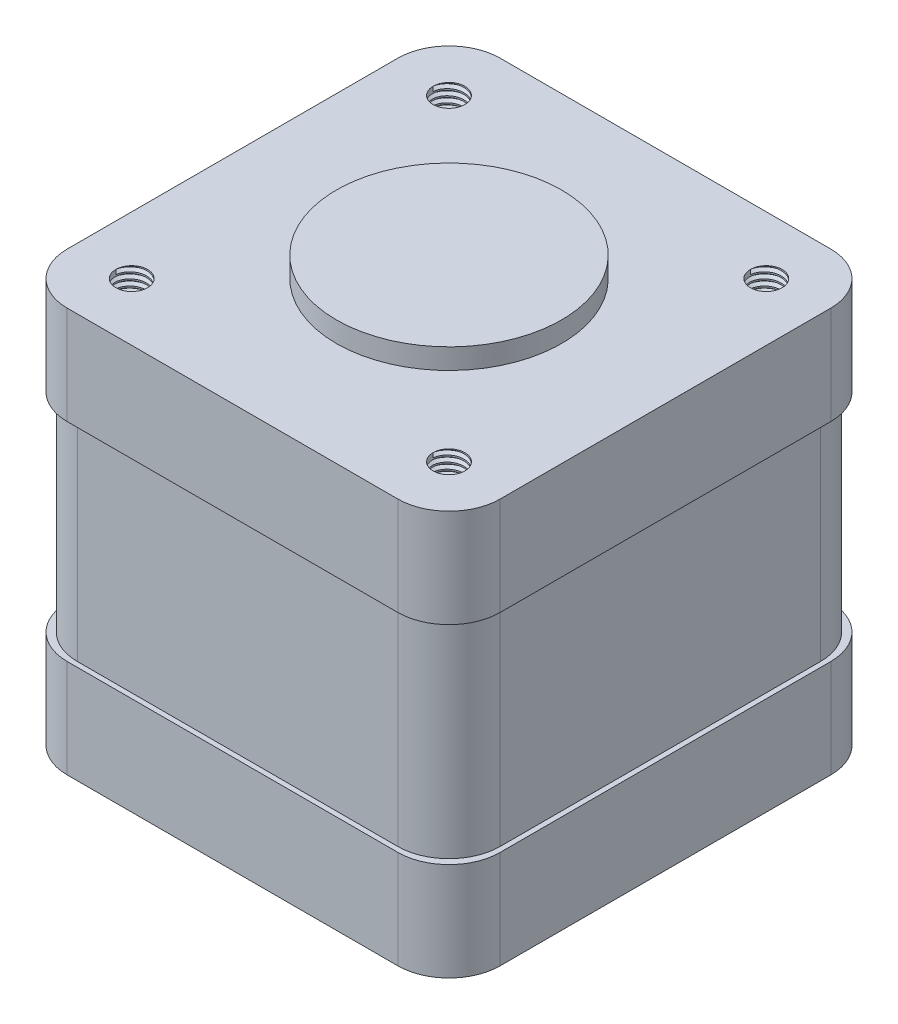
from build123d import *
from build123d.topology import SkipClean

# Parameters (mm, degrees)
BOSS_EXTRUDE1_DEPTH           = 9.6
BOSS_EXTRUDE2_DEPTH           = 20.3
BOSS_EXTRUDE3_DEPTH           = 9.6
SKETCH4_R                     = 1.55
CUT_EXTRUDE1_DEPTH            = 4.5
MINCOLWIDTH_ONTRACKING2_PITCH = 0.6
MINCOLWIDTH_ONTRACKING3_PITCH = 0.6
MINCOLWIDTH_ONTRACKING4_PITCH = 0.6
MINCOLWIDTH_ONTRACKING5_PITCH = 0.6
SKETCH18_R                    = 11
BOSS_EXTRUDE4_DEPTH           = 2


with BuildPart() as part:
    # Sketch1 → Boss-Extrude1 (new body)
    with BuildSketch(Plane(origin=(0, 0, 0), x_dir=(1, 0, 0), z_dir=(0, 1, 0))):
        with BuildLine():
            Line((5, 0), (37.3, 0))
            ThreePointArc((37.3, 0), (40.835533906, 1.464466094), (42.3, 5))
            Line((42.3, 5), (42.3, 37.3))
            ThreePointArc((42.3, 37.3), (40.835533906, 40.835533906), (37.3, 42.3))
            Line((37.3, 42.3), (5, 42.3))
            ThreePointArc((5, 42.3), (1.464466094, 40.835533906), (0, 37.3))
            Line((0, 37.3), (0, 5))
            ThreePointArc((0, 5), (1.464466094, 1.464466094), (5, 0))
        make_face()
    extrude(amount=BOSS_EXTRUDE1_DEPTH)

    # Sketch2 → Boss-Extrude2 (add)
    with BuildSketch(Plane(origin=(0, 9.6, 0), x_dir=(1, 0, 0), z_dir=(0, 1, 0))):
        with BuildLine():
            Line((5.5, 0.496711466), (36.8, 0.496711466))
            ThreePointArc((36.8, 0.496711466), (40.335533906, 1.96117756), (41.8, 5.496711466))
            Line((41.8, 5.496711466), (41.8, 36.8))
            ThreePointArc((41.8, 36.8), (40.335533906, 40.335533906), (36.8, 41.8))
            Line((36.8, 41.8), (5.5, 41.8))
            ThreePointArc((5.5, 41.8), (1.964466094, 40.335533906), (0.5, 36.8))
            Line((0.5, 36.8), (0.5, 5.496711466))
            ThreePointArc((0.5, 5.496711466), (1.964466094, 1.96117756), (5.5, 0.496711466))
        make_face()
    extrude(amount=BOSS_EXTRUDE2_DEPTH)

    # Sketch3 → Boss-Extrude3 (add)
    with BuildSketch(Plane(origin=(0, 29.9, 0), x_dir=(1, 0, 0), z_dir=(0, 1, 0))):
        with BuildLine():
            Line((5, 42.3), (37.3, 42.3))
            ThreePointArc((37.3, 42.3), (40.835533906, 40.835533906), (42.3, 37.3))
            Line((42.3, 37.3), (42.3, 5))
            ThreePointArc((42.3, 5), (40.835533906, 1.464466094), (37.3, 0))
            Line((37.3, 0), (5, 0))
            ThreePointArc((5, 0), (1.464466094, 1.464466094), (0, 5))
            Line((0, 5), (0, 37.3))
            ThreePointArc((0, 37.3), (1.464466094, 40.835533906), (5, 42.3))
        make_face()
    extrude(amount=BOSS_EXTRUDE3_DEPTH)

    # Sketch4 → Cut-Extrude1 (cut)
    with BuildSketch(Plane(origin=(0, 39.5, 0), x_dir=(1, 0, 0), z_dir=(0, 1, 0))):
        with Locations(Location((5.65, 36.65, 0), (0, 0, 270))):
            Circle(SKETCH4_R)
        with Locations(Location((36.65, 36.65, 0), (0, 0, 90))):
            Circle(SKETCH4_R)
        with Locations(Location((5.65, 5.65, 0), (0, 0, 90))):
            Circle(SKETCH4_R)
        with Locations(Location((36.65, 5.65, 0), (0, 0, 270))):
            Circle(SKETCH4_R)
    extrude(amount=-CUT_EXTRUDE1_DEPTH, mode=Mode.SUBTRACT)

    # MinColWidth_OnTracking2: the profile of HeaderRowsCount2 profile screwed along a right-hand helix of 7.5 turns, 6 arcs to a turn; built about Z, then put on its axis
    with SkipClean():  # the faces are left unmerged after this step: merging them gives an invalid solid
        mincolwidth_ontracking2_z = Axis((0, 0, 0), (0, 0, 1))
        mincolwidth_ontracking2_corners = [(1.5497, 0, -0.000173205), (1.874759525, 0, 0.187499999), (1.874759525, 0, 0.262499999), (1.5497, 0, 0.450173203)]
        with BuildLine(mode=Mode.PRIVATE) as mincolwidth_ontracking2_profile:
            Line(mincolwidth_ontracking2_corners[0], mincolwidth_ontracking2_corners[1])
            Line(mincolwidth_ontracking2_corners[1], mincolwidth_ontracking2_corners[2])
            Line(mincolwidth_ontracking2_corners[2], mincolwidth_ontracking2_corners[3])
            Line(mincolwidth_ontracking2_corners[3], mincolwidth_ontracking2_corners[0])
        mincolwidth_ontracking2_cap = Face(mincolwidth_ontracking2_profile.wire())
        mincolwidth_ontracking2_turn_angles = [0, 30, 60, 90, 120, 150, 180, 210, 240, 270, 300, 330, 360]
        mincolwidth_ontracking2_turn_weights = [1, 0.8660254037844387, 1, 0.8660254037844387, 1, 0.8660254037844387, 1, 0.8660254037844387, 1, 0.8660254037844387, 1, 0.8660254037844387, 1]
        mincolwidth_ontracking2_turn_rails = [Edge.make_bspline([Vector(p[0], p[1], 0).rotate(mincolwidth_ontracking2_z, mincolwidth_ontracking2_turn_angles[k]) / mincolwidth_ontracking2_turn_weights[k] + Vector(0, 0, p[2] + MINCOLWIDTH_ONTRACKING2_PITCH * mincolwidth_ontracking2_turn_angles[k] / 360) for k in range(13)], [0, 0, 0, 1, 1, 2, 2, 3, 3, 4, 4, 5, 5, 6, 6, 6], 2, mincolwidth_ontracking2_turn_weights) for p in mincolwidth_ontracking2_corners]
        mincolwidth_ontracking2_turn_sides = [Face.make_surface_from_curves(mincolwidth_ontracking2_turn_rails[p[0]], mincolwidth_ontracking2_turn_rails[p[1]]) for p in [(0, 1), (1, 2), (2, 3), (3, 0)]]
        mincolwidth_ontracking2_last_angles = [2520, 2550, 2580, 2610, 2640, 2670, 2700]
        mincolwidth_ontracking2_last_weights = [1, 0.8660254037844387, 1, 0.8660254037844387, 1, 0.8660254037844387, 1]
        mincolwidth_ontracking2_last_rails = [Edge.make_bspline([Vector(p[0], p[1], 0).rotate(mincolwidth_ontracking2_z, mincolwidth_ontracking2_last_angles[k]) / mincolwidth_ontracking2_last_weights[k] + Vector(0, 0, p[2] + MINCOLWIDTH_ONTRACKING2_PITCH * mincolwidth_ontracking2_last_angles[k] / 360) for k in range(7)], [0, 0, 0, 1, 1, 2, 2, 3, 3, 3], 2, mincolwidth_ontracking2_last_weights) for p in mincolwidth_ontracking2_corners]
        mincolwidth_ontracking2_last_sides = [Face.make_surface_from_curves(mincolwidth_ontracking2_last_rails[p[0]], mincolwidth_ontracking2_last_rails[p[1]]) for p in [(0, 1), (1, 2), (2, 3), (3, 0)]]
        mincolwidth_ontracking2 = Plane(origin=(5.65, 39.5, -36.65), x_dir=(-1, 0, 0), z_dir=(0, -1, 0)) * Solid(Shell([*[p.moved(Location((0, 0, MINCOLWIDTH_ONTRACKING2_PITCH * i))) for i in range(7) for p in mincolwidth_ontracking2_turn_sides], *mincolwidth_ontracking2_last_sides, mincolwidth_ontracking2_cap, mincolwidth_ontracking2_cap.rotate(mincolwidth_ontracking2_z, 2700).moved(Location((0, 0, MINCOLWIDTH_ONTRACKING2_PITCH * 2700 / 360)))]))
        add(mincolwidth_ontracking2, mode=Mode.SUBTRACT)

    # MinColWidth_OnTracking3: the profile of HeaderRowsCount3 profile screwed along a right-hand helix of 7.5 turns, 6 arcs to a turn; built about Z, then put on its axis
    with SkipClean():  # the faces are left unmerged after this step: merging them gives an invalid solid
        mincolwidth_ontracking3_z = Axis((0, 0, 0), (0, 0, 1))
        mincolwidth_ontracking3_corners = [(1.5497, 0, -0.000173205), (1.874759525, 0, 0.187499999), (1.874759525, 0, 0.262499999), (1.5497, 0, 0.450173203)]
        with BuildLine(mode=Mode.PRIVATE) as mincolwidth_ontracking3_profile:
            Line(mincolwidth_ontracking3_corners[0], mincolwidth_ontracking3_corners[1])
            Line(mincolwidth_ontracking3_corners[1], mincolwidth_ontracking3_corners[2])
            Line(mincolwidth_ontracking3_corners[2], mincolwidth_ontracking3_corners[3])
            Line(mincolwidth_ontracking3_corners[3], mincolwidth_ontracking3_corners[0])
        mincolwidth_ontracking3_cap = Face(mincolwidth_ontracking3_profile.wire())
        mincolwidth_ontracking3_turn_angles = [0, 30, 60, 90, 120, 150, 180, 210, 240, 270, 300, 330, 360]
        mincolwidth_ontracking3_turn_weights = [1, 0.8660254037844387, 1, 0.8660254037844387, 1, 0.8660254037844387, 1, 0.8660254037844387, 1, 0.8660254037844387, 1, 0.8660254037844387, 1]
        mincolwidth_ontracking3_turn_rails = [Edge.make_bspline([Vector(p[0], p[1], 0).rotate(mincolwidth_ontracking3_z, mincolwidth_ontracking3_turn_angles[k]) / mincolwidth_ontracking3_turn_weights[k] + Vector(0, 0, p[2] + MINCOLWIDTH_ONTRACKING3_PITCH * mincolwidth_ontracking3_turn_angles[k] / 360) for k in range(13)], [0, 0, 0, 1, 1, 2, 2, 3, 3, 4, 4, 5, 5, 6, 6, 6], 2, mincolwidth_ontracking3_turn_weights) for p in mincolwidth_ontracking3_corners]
        mincolwidth_ontracking3_turn_sides = [Face.make_surface_from_curves(mincolwidth_ontracking3_turn_rails[p[0]], mincolwidth_ontracking3_turn_rails[p[1]]) for p in [(0, 1), (1, 2), (2, 3), (3, 0)]]
        mincolwidth_ontracking3_last_angles = [2520, 2550, 2580, 2610, 2640, 2670, 2700]
        mincolwidth_ontracking3_last_weights = [1, 0.8660254037844387, 1, 0.8660254037844387, 1, 0.8660254037844387, 1]
        mincolwidth_ontracking3_last_rails = [Edge.make_bspline([Vector(p[0], p[1], 0).rotate(mincolwidth_ontracking3_z, mincolwidth_ontracking3_last_angles[k]) / mincolwidth_ontracking3_last_weights[k] + Vector(0, 0, p[2] + MINCOLWIDTH_ONTRACKING3_PITCH * mincolwidth_ontracking3_last_angles[k] / 360) for k in range(7)], [0, 0, 0, 1, 1, 2, 2, 3, 3, 3], 2, mincolwidth_ontracking3_last_weights) for p in mincolwidth_ontracking3_corners]
        mincolwidth_ontracking3_last_sides = [Face.make_surface_from_curves(mincolwidth_ontracking3_last_rails[p[0]], mincolwidth_ontracking3_last_rails[p[1]]) for p in [(0, 1), (1, 2), (2, 3), (3, 0)]]
        mincolwidth_ontracking3 = Plane(origin=(36.65, 39.5, -36.65), x_dir=(-1, 0, 0), z_dir=(0, -1, 0)) * Solid(Shell([*[p.moved(Location((0, 0, MINCOLWIDTH_ONTRACKING3_PITCH * i))) for i in range(7) for p in mincolwidth_ontracking3_turn_sides], *mincolwidth_ontracking3_last_sides, mincolwidth_ontracking3_cap, mincolwidth_ontracking3_cap.rotate(mincolwidth_ontracking3_z, 2700).moved(Location((0, 0, MINCOLWIDTH_ONTRACKING3_PITCH * 2700 / 360)))]))
        add(mincolwidth_ontracking3, mode=Mode.SUBTRACT)

    # MinColWidth_OnTracking4: the profile of HeaderRowsCount4 profile screwed along a right-hand helix of 7.5 turns, 6 arcs to a turn; built about Z, then put on its axis
    with SkipClean():  # the faces are left unmerged after this step: merging them gives an invalid solid
        mincolwidth_ontracking4_z = Axis((0, 0, 0), (0, 0, 1))
        mincolwidth_ontracking4_corners = [(1.5497, 0, -0.000173205), (1.874759525, 0, 0.187499999), (1.874759525, 0, 0.262499999), (1.5497, 0, 0.450173203)]
        with BuildLine(mode=Mode.PRIVATE) as mincolwidth_ontracking4_profile:
            Line(mincolwidth_ontracking4_corners[0], mincolwidth_ontracking4_corners[1])
            Line(mincolwidth_ontracking4_corners[1], mincolwidth_ontracking4_corners[2])
            Line(mincolwidth_ontracking4_corners[2], mincolwidth_ontracking4_corners[3])
            Line(mincolwidth_ontracking4_corners[3], mincolwidth_ontracking4_corners[0])
        mincolwidth_ontracking4_cap = Face(mincolwidth_ontracking4_profile.wire())
        mincolwidth_ontracking4_turn_angles = [0, 30, 60, 90, 120, 150, 180, 210, 240, 270, 300, 330, 360]
        mincolwidth_ontracking4_turn_weights = [1, 0.8660254037844387, 1, 0.8660254037844387, 1, 0.8660254037844387, 1, 0.8660254037844387, 1, 0.8660254037844387, 1, 0.8660254037844387, 1]
        mincolwidth_ontracking4_turn_rails = [Edge.make_bspline([Vector(p[0], p[1], 0).rotate(mincolwidth_ontracking4_z, mincolwidth_ontracking4_turn_angles[k]) / mincolwidth_ontracking4_turn_weights[k] + Vector(0, 0, p[2] + MINCOLWIDTH_ONTRACKING4_PITCH * mincolwidth_ontracking4_turn_angles[k] / 360) for k in range(13)], [0, 0, 0, 1, 1, 2, 2, 3, 3, 4, 4, 5, 5, 6, 6, 6], 2, mincolwidth_ontracking4_turn_weights) for p in mincolwidth_ontracking4_corners]
        mincolwidth_ontracking4_turn_sides = [Face.make_surface_from_curves(mincolwidth_ontracking4_turn_rails[p[0]], mincolwidth_ontracking4_turn_rails[p[1]]) for p in [(0, 1), (1, 2), (2, 3), (3, 0)]]
        mincolwidth_ontracking4_last_angles = [2520, 2550, 2580, 2610, 2640, 2670, 2700]
        mincolwidth_ontracking4_last_weights = [1, 0.8660254037844387, 1, 0.8660254037844387, 1, 0.8660254037844387, 1]
        mincolwidth_ontracking4_last_rails = [Edge.make_bspline([Vector(p[0], p[1], 0).rotate(mincolwidth_ontracking4_z, mincolwidth_ontracking4_last_angles[k]) / mincolwidth_ontracking4_last_weights[k] + Vector(0, 0, p[2] + MINCOLWIDTH_ONTRACKING4_PITCH * mincolwidth_ontracking4_last_angles[k] / 360) for k in range(7)], [0, 0, 0, 1, 1, 2, 2, 3, 3, 3], 2, mincolwidth_ontracking4_last_weights) for p in mincolwidth_ontracking4_corners]
        mincolwidth_ontracking4_last_sides = [Face.make_surface_from_curves(mincolwidth_ontracking4_last_rails[p[0]], mincolwidth_ontracking4_last_rails[p[1]]) for p in [(0, 1), (1, 2), (2, 3), (3, 0)]]
        mincolwidth_ontracking4 = Plane(origin=(5.65, 39.5, -5.65), x_dir=(-1, 0, 0), z_dir=(0, -1, 0)) * Solid(Shell([*[p.moved(Location((0, 0, MINCOLWIDTH_ONTRACKING4_PITCH * i))) for i in range(7) for p in mincolwidth_ontracking4_turn_sides], *mincolwidth_ontracking4_last_sides, mincolwidth_ontracking4_cap, mincolwidth_ontracking4_cap.rotate(mincolwidth_ontracking4_z, 2700).moved(Location((0, 0, MINCOLWIDTH_ONTRACKING4_PITCH * 2700 / 360)))]))
        add(mincolwidth_ontracking4, mode=Mode.SUBTRACT)

    # MinColWidth_OnTracking5: the profile of HeaderRowsCount5 profile screwed along a right-hand helix of 7.5 turns, 6 arcs to a turn; built about Z, then put on its axis
    with SkipClean():  # the faces are left unmerged after this step: merging them gives an invalid solid
        mincolwidth_ontracking5_z = Axis((0, 0, 0), (0, 0, 1))
        mincolwidth_ontracking5_corners = [(1.5497, 0, -0.000173205), (1.874759525, 0, 0.187499999), (1.874759525, 0, 0.262499999), (1.5497, 0, 0.450173203)]
        with BuildLine(mode=Mode.PRIVATE) as mincolwidth_ontracking5_profile:
            Line(mincolwidth_ontracking5_corners[0], mincolwidth_ontracking5_corners[1])
            Line(mincolwidth_ontracking5_corners[1], mincolwidth_ontracking5_corners[2])
            Line(mincolwidth_ontracking5_corners[2], mincolwidth_ontracking5_corners[3])
            Line(mincolwidth_ontracking5_corners[3], mincolwidth_ontracking5_corners[0])
        mincolwidth_ontracking5_cap = Face(mincolwidth_ontracking5_profile.wire())
        mincolwidth_ontracking5_turn_angles = [0, 30, 60, 90, 120, 150, 180, 210, 240, 270, 300, 330, 360]
        mincolwidth_ontracking5_turn_weights = [1, 0.8660254037844387, 1, 0.8660254037844387, 1, 0.8660254037844387, 1, 0.8660254037844387, 1, 0.8660254037844387, 1, 0.8660254037844387, 1]
        mincolwidth_ontracking5_turn_rails = [Edge.make_bspline([Vector(p[0], p[1], 0).rotate(mincolwidth_ontracking5_z, mincolwidth_ontracking5_turn_angles[k]) / mincolwidth_ontracking5_turn_weights[k] + Vector(0, 0, p[2] + MINCOLWIDTH_ONTRACKING5_PITCH * mincolwidth_ontracking5_turn_angles[k] / 360) for k in range(13)], [0, 0, 0, 1, 1, 2, 2, 3, 3, 4, 4, 5, 5, 6, 6, 6], 2, mincolwidth_ontracking5_turn_weights) for p in mincolwidth_ontracking5_corners]
        mincolwidth_ontracking5_turn_sides = [Face.make_surface_from_curves(mincolwidth_ontracking5_turn_rails[p[0]], mincolwidth_ontracking5_turn_rails[p[1]]) for p in [(0, 1), (1, 2), (2, 3), (3, 0)]]
        mincolwidth_ontracking5_last_angles = [2520, 2550, 2580, 2610, 2640, 2670, 2700]
        mincolwidth_ontracking5_last_weights = [1, 0.8660254037844387, 1, 0.8660254037844387, 1, 0.8660254037844387, 1]
        mincolwidth_ontracking5_last_rails = [Edge.make_bspline([Vector(p[0], p[1], 0).rotate(mincolwidth_ontracking5_z, mincolwidth_ontracking5_last_angles[k]) / mincolwidth_ontracking5_last_weights[k] + Vector(0, 0, p[2] + MINCOLWIDTH_ONTRACKING5_PITCH * mincolwidth_ontracking5_last_angles[k] / 360) for k in range(7)], [0, 0, 0, 1, 1, 2, 2, 3, 3, 3], 2, mincolwidth_ontracking5_last_weights) for p in mincolwidth_ontracking5_corners]
        mincolwidth_ontracking5_last_sides = [Face.make_surface_from_curves(mincolwidth_ontracking5_last_rails[p[0]], mincolwidth_ontracking5_last_rails[p[1]]) for p in [(0, 1), (1, 2), (2, 3), (3, 0)]]
        mincolwidth_ontracking5 = Plane(origin=(36.65, 39.5, -5.65), x_dir=(-1, 0, 0), z_dir=(0, -1, 0)) * Solid(Shell([*[p.moved(Location((0, 0, MINCOLWIDTH_ONTRACKING5_PITCH * i))) for i in range(7) for p in mincolwidth_ontracking5_turn_sides], *mincolwidth_ontracking5_last_sides, mincolwidth_ontracking5_cap, mincolwidth_ontracking5_cap.rotate(mincolwidth_ontracking5_z, 2700).moved(Location((0, 0, MINCOLWIDTH_ONTRACKING5_PITCH * 2700 / 360)))]))
        add(mincolwidth_ontracking5, mode=Mode.SUBTRACT)

    # Sketch18 → Boss-Extrude4 (add)
    with SkipClean():  # the faces are left unmerged after this step: merging them gives an invalid solid
        with BuildSketch(Plane(origin=(0, 39.5, 0), x_dir=(1, 0, 0), z_dir=(0, 1, 0))):
            with Locations(Location((21.15, 21.15, 0), (0, 0, 90))):
                Circle(SKETCH18_R)
        extrude(amount=BOSS_EXTRUDE4_DEPTH)


solid = part.part
